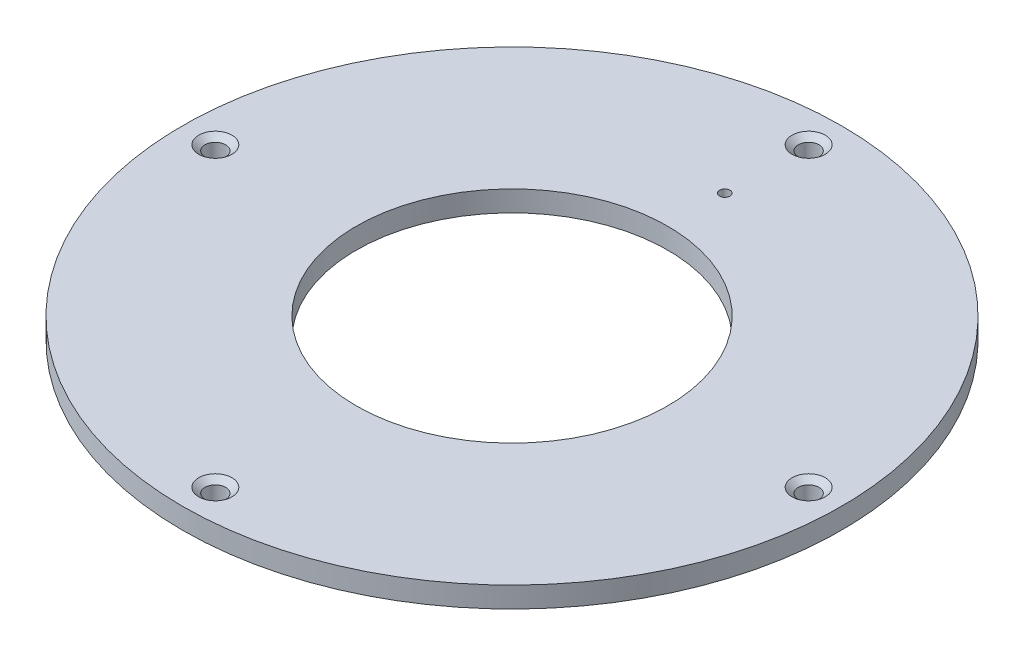
from build123d import *

# Parameters (mm, degrees)
SKETCH1_R                                       = 15.875
BOSS_EXTRUDE1_DEPTH                             = 1
CUT_EXTRUDE1_DEPTH                              = 23.472900347
CUT_EXTRUDE1_DEPTH_BACK                         = 23.472900347
SKETCH2_R                                       = 7.5
CUT_EXTRUDE2_DEPTH                              = 23.472900347
CUT_EXTRUDE2_DEPTH_BACK                         = 23.472900347
SKETCH4_R                                       = 0.25
CSK_FOR_M2_FLAT_HEAD_MACHINE_SCREW1_D           = 1
CSK_FOR_M2_FLAT_HEAD_MACHINE_SCREW1_CSINK_D     = 1.6
CSK_FOR_M2_FLAT_HEAD_MACHINE_SCREW1_CSINK_ANGLE = 100


with BuildPart() as part:
    # Sketch1 → Boss-Extrude1 (new body)
    with BuildSketch(Plane(origin=(0, 0, 0), x_dir=(1, 0, 0), z_dir=(0, 1, 0))):
        Circle(SKETCH1_R)
    extrude(amount=BOSS_EXTRUDE1_DEPTH)

    # Sketch2 → Cut-Extrude1 (cut, two sides: drawn at the far end of the back side and taken through both)
    with BuildSketch(Plane(origin=(0, 1, 0), x_dir=(1, 0, 0), z_dir=(0, 1, 0)).offset(-CUT_EXTRUDE1_DEPTH_BACK)):
        Circle(SKETCH2_R)
    extrude(amount=CUT_EXTRUDE1_DEPTH + CUT_EXTRUDE1_DEPTH_BACK, mode=Mode.SUBTRACT)

    # Sketch4 → Cut-Extrude2 (cut, two sides: drawn at the far end of the back side and taken through both)
    with BuildSketch(Plane(origin=(0, 1, 0), x_dir=(1, 0, 0), z_dir=(0, 1, 0)).offset(-CUT_EXTRUDE2_DEPTH_BACK)):
        with Locations((0, 10.25)):
            Circle(SKETCH4_R)
    extrude(amount=CUT_EXTRUDE2_DEPTH + CUT_EXTRUDE2_DEPTH_BACK, mode=Mode.SUBTRACT)

    # CSK for M2 Flat Head Machine Screw1 (through all)
    with Locations(Plane(origin=(0, 1, 0), x_dir=(1, 0, 0), z_dir=(0, 1, 0))):
        with Locations((0, 14.29), (14.29, 0), (0, -14.29), (-14.29, 0)):
            CounterSinkHole(CSK_FOR_M2_FLAT_HEAD_MACHINE_SCREW1_D / 2, CSK_FOR_M2_FLAT_HEAD_MACHINE_SCREW1_CSINK_D / 2, counter_sink_angle=CSK_FOR_M2_FLAT_HEAD_MACHINE_SCREW1_CSINK_ANGLE)


solid = part.part
